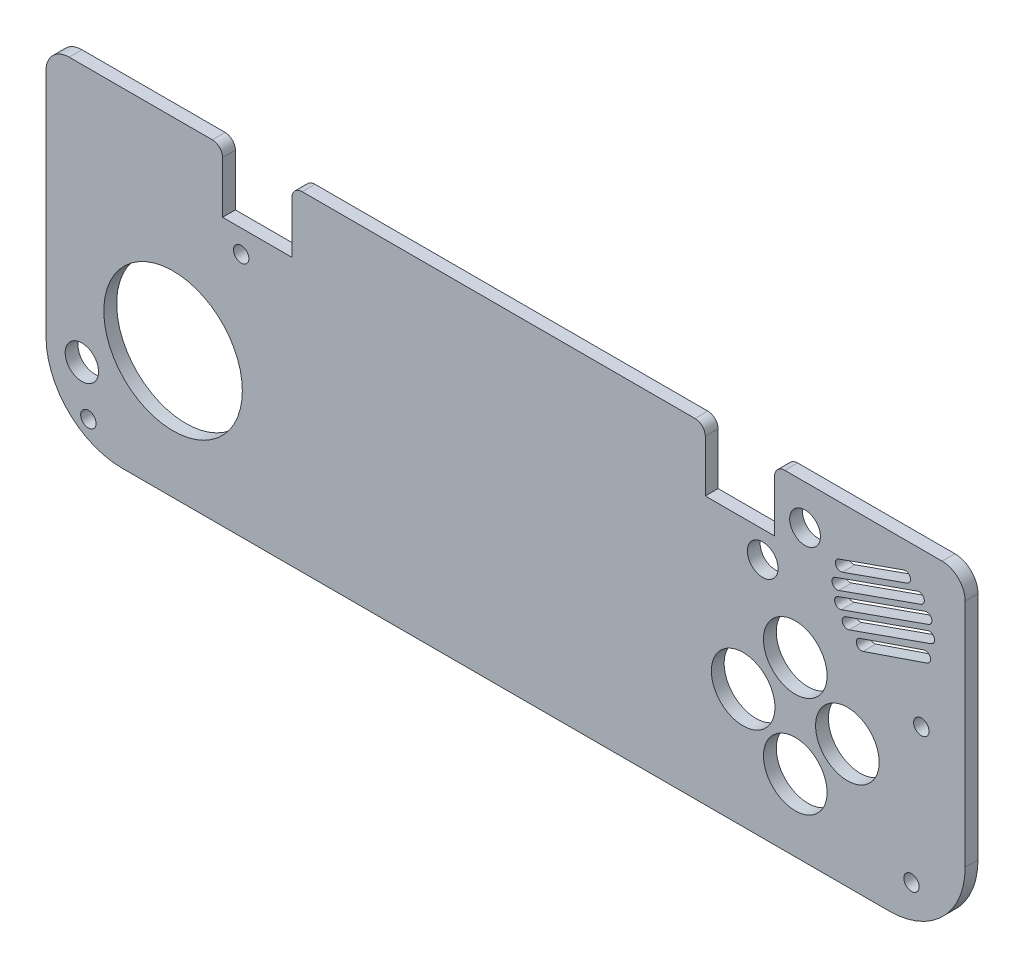
from build123d import *

# Parameters (mm, degrees)
BOSS_EXTRU_1_DEPTH       = 2.5
ESQUISSE22_R             = 13.5
ENL_V_MAT_EXTRU_1_DEPTH  = 2.5
ESQUISSE23_R             = 3.25
ENL_V_MAT_EXTRU_2_DEPTH  = 2.5
ESQUISSE24_W             = 13.5
ESQUISSE24_H             = 8.72
ENL_V_MAT_EXTRU_3_DEPTH  = 2.5
ESQUISSE25_W             = 13.5
ESQUISSE25_H             = 3.371774097
ENL_V_MAT_EXTRU_4_DEPTH  = 2.5
CONG_1_R                 = 2
ESQUISSE26_R             = 6.2
ENL_V_MAT_EXTRU_5_DEPTH  = 2.5
ESQUISSE27_R             = 6.2
ENL_V_MAT_EXTRU_6_DEPTH  = 2.5
ESQUISSE30_W             = 13.5
ESQUISSE30_H             = 12.08
ENL_V_MAT_EXTRU_7_DEPTH  = 2.5
CONG_2_R                 = 2
ESQUISSE31_R             = 3
ENL_V_MAT_EXTRU_8_DEPTH  = 2.5
ENL_V_MAT_EXTRU_9_DEPTH  = 2.5
ESQUISSE33_R             = 1.5
ENL_V_MAT_EXTRU_10_DEPTH = 10
ESQUISSE34_R             = 1.5
ENL_V_MAT_EXTRU_11_DEPTH = 10
ESQUISSE35_R             = 1.5
ENL_V_MAT_EXTRU_12_DEPTH = 10
ESQUISSE36_R             = 1.5
ENL_V_MAT_EXTRU_13_DEPTH = 10


with BuildPart() as part:
    # Esquisse20 → Boss.-Extru.1 (new body)
    with BuildSketch(Plane.XY):
        with BuildLine():
            Line((14.8, -2), (164.37, -2))
            ThreePointArc((164.37, -2), (174.835180362, 2.334819638), (179.17, 12.8))
            Line((179.17, 12.8), (179.17, 57.73))
            ThreePointArc((179.17, 57.73), (177.851980515, 60.911980515), (174.67, 62.23))
            Line((174.67, 62.23), (4.5, 62.23))
            ThreePointArc((4.5, 62.23), (1.318019485, 60.911980515), (0, 57.73))
            Line((0, 57.73), (0, 12.8))
            ThreePointArc((0, 12.8), (4.334819638, 2.334819638), (14.8, -2))
        make_face()
    extrude(amount=BOSS_EXTRU_1_DEPTH)

    # Esquisse22 → Enlèv. mat.-Extru.1 (cut)
    with BuildSketch(Plane.XY.offset(2.5)):
        with Locations((24.77, 22.77)):
            Circle(ESQUISSE22_R)
    extrude(amount=-ENL_V_MAT_EXTRU_1_DEPTH, mode=Mode.SUBTRACT)

    # Esquisse23 → Enlèv. mat.-Extru.2 (cut)
    with BuildSketch(Plane.XY.offset(2.5)):
        with Locations((6.99, 11.97)):
            Circle(ESQUISSE23_R)
        with Locations((-24.978214815, 23.569105699)):
            Circle(ESQUISSE23_R)
    extrude(amount=-ENL_V_MAT_EXTRU_2_DEPTH, mode=Mode.SUBTRACT)

    # Esquisse24 → Enlèv. mat.-Extru.3 (cut)
    with BuildSketch(Plane.XY.offset(2.5)):
        with Locations((41.17, 54.51)):
            Rectangle(ESQUISSE24_W, ESQUISSE24_H)
    extrude(amount=-ENL_V_MAT_EXTRU_3_DEPTH, mode=Mode.SUBTRACT)

    # Esquisse25 → Enlèv. mat.-Extru.4 (cut)
    with BuildSketch(Plane.XY.offset(2.5)):
        with Locations((41.17, 60.555887049)):
            Rectangle(ESQUISSE25_W, ESQUISSE25_H)
    extrude(amount=-ENL_V_MAT_EXTRU_4_DEPTH, mode=Mode.SUBTRACT)

    # Congé1
    cong_1_edges = [part.edges().sort_by_distance(p)[0] for p in [
        (47.92, 62.23, 1.25),
        (34.42, 62.23, 1.25),
    ]]
    fillet(cong_1_edges, radius=CONG_1_R)

    # Esquisse26 → Enlèv. mat.-Extru.5 (cut)
    with BuildSketch(Plane.XY.offset(2.5)):
        with Locations((156.21, 22.13)):
            Circle(ESQUISSE26_R)
    extrude(amount=-ENL_V_MAT_EXTRU_5_DEPTH, mode=Mode.SUBTRACT)

    # Esquisse27 → Enlèv. mat.-Extru.6 (cut)
    with BuildSketch(Plane.XY.offset(2.5)):
        with Locations((146.05, 11.97)):
            Circle(ESQUISSE27_R)
        with Locations((135.89, 21.23)):
            Circle(ESQUISSE27_R)
        with Locations((146.05, 31.65)):
            Circle(ESQUISSE27_R)
    extrude(amount=-ENL_V_MAT_EXTRU_6_DEPTH, mode=Mode.SUBTRACT)

    # Esquisse30 → Enlèv. mat.-Extru.7 (cut)
    with BuildSketch(Plane.XY.offset(2.5)):
        with Locations((135.26, 56.19)):
            Rectangle(ESQUISSE30_W, ESQUISSE30_H)
    extrude(amount=-ENL_V_MAT_EXTRU_7_DEPTH, mode=Mode.SUBTRACT)

    # Congé2
    cong_2_edges = [part.edges().sort_by_distance(p)[0] for p in [
        (142.01, 62.23, 1.25),
        (128.51, 62.23, 1.25),
    ]]
    fillet(cong_2_edges, radius=CONG_2_R)

    # Esquisse31 → Enlèv. mat.-Extru.8 (cut)
    with BuildSketch(Plane.XY.offset(2.5)):
        with Locations((147.96, 54.51)):
            Circle(ESQUISSE31_R)
        with Locations((139.7, 44.99)):
            Circle(ESQUISSE31_R)
    extrude(amount=-ENL_V_MAT_EXTRU_8_DEPTH, mode=Mode.SUBTRACT)

    # Esquisse32 → Enlèv. mat.-Extru.9 (cut)
    with BuildSketch(Plane.XY.offset(2.5)):
        with BuildLine():
            Line((172.018614708, 50.217190958), (155.048051959, 44.217190958))
            ThreePointArc((155.048051959, 44.217190958), (153.771909584, 44.826666667), (154.381385292, 46.102809042))
            Line((154.381385292, 46.102809042), (171.351948041, 52.102809042))
            ThreePointArc((171.351948041, 52.102809042), (172.628090416, 51.493333333), (172.018614708, 50.217190958))
        make_face()
        with BuildLine():
            Line((153.866666667, 49.102809042), (169.866666667, 54.759663291))
            ThreePointArc((169.866666667, 54.759663291), (171.142809042, 54.150187583), (170.533333333, 52.874045208))
            Line((170.533333333, 52.874045208), (154.533333333, 47.217190958))
            ThreePointArc((154.533333333, 47.217190958), (153.257190958, 47.826666667), (153.866666667, 49.102809042))
        make_face()
        with BuildLine():
            Line((154.542111346, 52.523595314), (167.191221987, 56.995731269))
            ThreePointArc((167.191221987, 56.995731269), (168.467364362, 56.38625556), (167.857888654, 55.110113185))
            Line((167.857888654, 55.110113185), (155.208778013, 50.63797723))
            ThreePointArc((155.208778013, 50.63797723), (153.932635638, 51.247452939), (154.542111346, 52.523595314))
        make_face()
        with BuildLine():
            Line((155.866666667, 43.445954792), (171.866666667, 49.102809042))
            ThreePointArc((171.866666667, 49.102809042), (173.142809042, 48.493333333), (172.533333333, 47.217190958))
            Line((172.533333333, 47.217190958), (156.533333333, 41.560336709))
            ThreePointArc((156.533333333, 41.560336709), (155.257190958, 42.169812417), (155.866666667, 43.445954792))
        make_face()
        with BuildLine():
            Line((158.617948097, 41.177385778), (171.09857492, 45.446217537))
            ThreePointArc((171.09857492, 45.446217537), (172.368388344, 44.823663229), (171.745834035, 43.553849804))
            Line((171.745834035, 43.553849804), (159.265207213, 39.285018045))
            ThreePointArc((159.265207213, 39.285018045), (157.995393788, 39.907572354), (158.617948097, 41.177385778))
        make_face()
    extrude(amount=-ENL_V_MAT_EXTRU_9_DEPTH, mode=Mode.SUBTRACT)

    # Esquisse33 → Enlèv. mat.-Extru.10 (cut)
    with BuildSketch(Plane.XY.offset(2.5)):
        with Locations((38.04665377, 45.73428297)):
            Circle(ESQUISSE33_R)
    extrude(amount=-ENL_V_MAT_EXTRU_10_DEPTH, mode=Mode.SUBTRACT)

    # Esquisse34 → Enlèv. mat.-Extru.11 (cut)
    with BuildSketch(Plane.XY.offset(2.5)):
        with Locations((8.26, 2.99)):
            Circle(ESQUISSE34_R)
    extrude(amount=-ENL_V_MAT_EXTRU_11_DEPTH, mode=Mode.SUBTRACT)

    # Esquisse35 → Enlèv. mat.-Extru.12 (cut)
    with BuildSketch(Plane.XY.offset(2.5)):
        with Locations((168.71, 5)):
            Circle(ESQUISSE35_R)
    extrude(amount=-ENL_V_MAT_EXTRU_12_DEPTH, mode=Mode.SUBTRACT)

    # Esquisse36 → Enlèv. mat.-Extru.13 (cut)
    with BuildSketch(Plane.XY.offset(2.5)):
        with Locations((170.62, 32.23)):
            Circle(ESQUISSE36_R)
    extrude(amount=-ENL_V_MAT_EXTRU_13_DEPTH, mode=Mode.SUBTRACT)


solid = part.part
